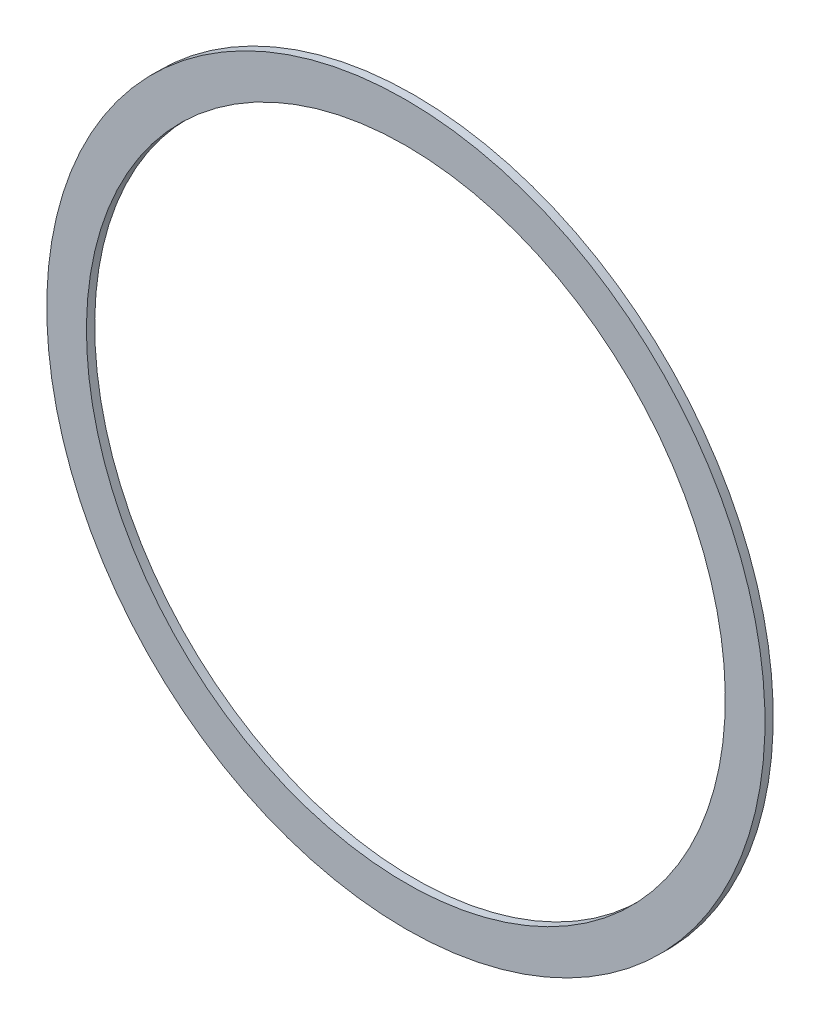
from build123d import *

# Parameters (mm, degrees)
SKETCH2_R           = 137.922
SKETCH2_R_2         = 122.682
BOSS_EXTRUDE2_DEPTH = 1.5875


with BuildPart() as part:
    # Sketch2 → Boss-Extrude2 (new, symmetric)
    with BuildSketch(Plane(origin=(248.273568551, -245.01347209, 0), x_dir=(0, -1, 0), z_dir=(0, 0, -1))):
        with Locations((-257.71347209, 248.273568551)):
            Circle(SKETCH2_R)
        with Locations((-257.71347209, 248.273568551)):
            Circle(SKETCH2_R_2, mode=Mode.SUBTRACT)
    extrude(amount=BOSS_EXTRUDE2_DEPTH, both=True)


solid = part.part
